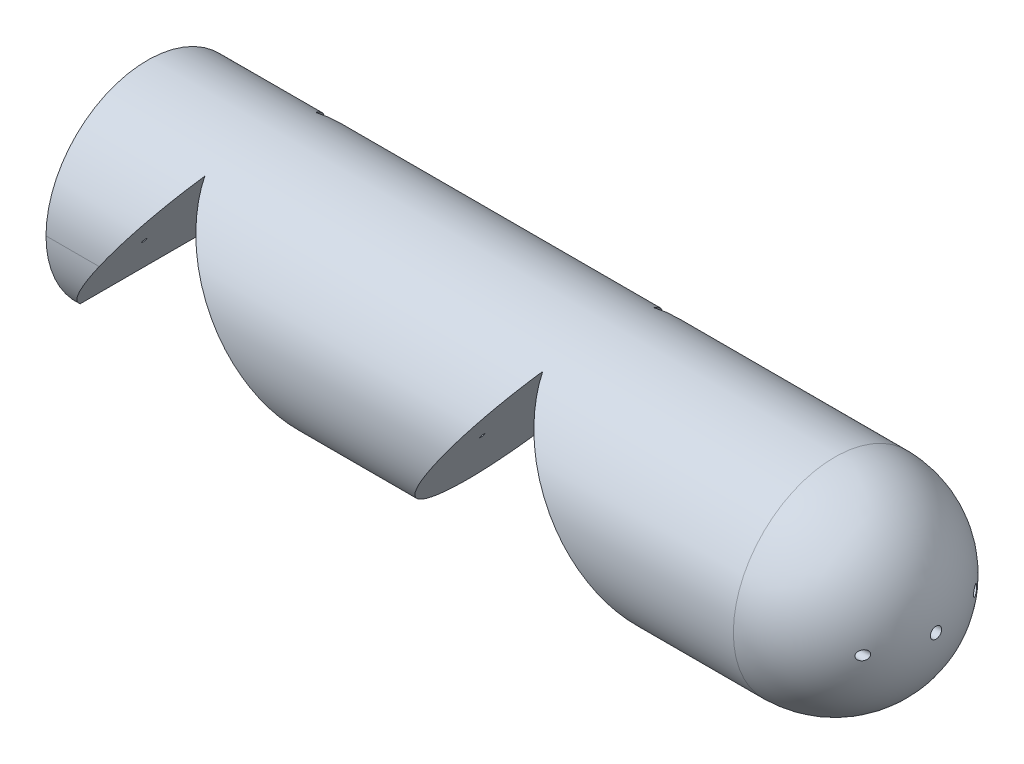
from build123d import *

# Parameters (mm, degrees)
SKETCH1_W                    = 70
SKETCH1_H                    = 9
FILLET1_R                    = 9
CUT_EXTRUDE1_DEPTH           = 15
SKETCH4_R                    = 0.2
CUT_EXTRUDE2_DEPTH           = 73.835430939
SKETCH5_R                    = 0.5
CUT_EXTRUDE3_DEPTH           = 5
CUT_EXTRUDE3_DRAFT           = -3
CUT_EXTRUDE3_PROFILE_2_DEPTH = 5
CUT_EXTRUDE3_PROFILE_2_DRAFT = -3
CUT_EXTRUDE3_PROFILE_3_DEPTH = 5
CUT_EXTRUDE3_PROFILE_3_DRAFT = -3


with BuildPart() as part:
    # Sketch1 → Revolve1 (revolve)
    with BuildSketch(Plane.XY):
        with Locations((35, 4.5)):
            Rectangle(SKETCH1_W, SKETCH1_H)
    revolve(axis=Axis((0, 9, 0), (1, 0, 0)))

    # Fillet1
    fillet1_edges = [part.edges().sort_by_distance(p)[0] for p in [
        (70, 18, 0),
    ]]
    fillet(fillet1_edges, radius=FILLET1_R)

    # Sketch2 → Cut-Extrude1 (cut, symmetric)
    with BuildSketch(Plane.XY):
        Polygon((-1.583487195, 0), (21.583487195, 0), (10, 16.542934148), align=None)
        Polygon((40, 16.542934148), (28.416512805, 0), (51.583487195, 0), align=None)
    extrude(amount=CUT_EXTRUDE1_DEPTH, both=True, mode=Mode.SUBTRACT)

    # Sketch4 → Cut-Extrude2 (cut, through all)
    with BuildSketch(Plane.ZY):
        with Locations((5, 9)):
            Circle(SKETCH4_R)
        with Locations((0, 9)):
            Circle(SKETCH4_R)
        with Locations((-5, 9)):
            Circle(SKETCH4_R)
    extrude(amount=-CUT_EXTRUDE2_DEPTH, mode=Mode.SUBTRACT)


with BuildPart() as cut_extrude3_tool:
    # Sketch5 → Cut-Extrude3 (with draft: the straight prism first)
    with BuildSketch(Plane(origin=(69.997777503, 0, 0), x_dir=(0, 0, -1), z_dir=(1, 0, 0))):
        with Locations((-5, 9)):
            Circle(SKETCH5_R)
    extrude(amount=-CUT_EXTRUDE3_DEPTH)
    # Cut-Extrude3: the draft: its side faces are tilted about the plane it starts from
    cut_extrude3_sides = [cut_extrude3_tool.faces().sort_by_distance(p)[0] for p in [
        (67.497777503, 9, 5.5),
    ]]
    draft(cut_extrude3_sides, Plane(origin=(69.997777503, 0, 0), x_dir=(0, 0, -1), z_dir=(1, 0, 0)), CUT_EXTRUDE3_DRAFT)


with BuildPart() as part_1:
    add(part.part)

    # Cut-Extrude3: cut by cut_extrude3_tool
    add(cut_extrude3_tool.part, mode=Mode.SUBTRACT)


with BuildPart() as cut_extrude3_profile_2_tool:
    # Sketch5 → Cut-Extrude3 profile 2 (with draft: the straight prism first)
    with BuildSketch(Plane(origin=(69.997777503, 0, 0), x_dir=(0, 0, -1), z_dir=(1, 0, 0))):
        with Locations((0, 9)):
            Circle(SKETCH5_R)
    extrude(amount=-CUT_EXTRUDE3_PROFILE_2_DEPTH)
    # Cut-Extrude3 profile 2: the draft: its side faces are tilted about the plane it starts from
    cut_extrude3_profile_2_sides = [cut_extrude3_profile_2_tool.faces().sort_by_distance(p)[0] for p in [
        (67.497777503, 9, 0.5),
    ]]
    draft(cut_extrude3_profile_2_sides, Plane(origin=(69.997777503, 0, 0), x_dir=(0, 0, -1), z_dir=(1, 0, 0)), CUT_EXTRUDE3_PROFILE_2_DRAFT)


with BuildPart() as part_2:
    add(part_1.part)

    # Cut-Extrude3 profile 2: cut by cut_extrude3_profile_2_tool
    add(cut_extrude3_profile_2_tool.part, mode=Mode.SUBTRACT)


with BuildPart() as cut_extrude3_profile_3_tool:
    # Sketch5 → Cut-Extrude3 profile 3 (with draft: the straight prism first)
    with BuildSketch(Plane(origin=(69.997777503, 0, 0), x_dir=(0, 0, -1), z_dir=(1, 0, 0))):
        with Locations((5, 9)):
            Circle(SKETCH5_R)
    extrude(amount=-CUT_EXTRUDE3_PROFILE_3_DEPTH)
    # Cut-Extrude3 profile 3: the draft: its side faces are tilted about the plane it starts from
    cut_extrude3_profile_3_sides = [cut_extrude3_profile_3_tool.faces().sort_by_distance(p)[0] for p in [
        (67.497777503, 9, -4.5),
    ]]
    draft(cut_extrude3_profile_3_sides, Plane(origin=(69.997777503, 0, 0), x_dir=(0, 0, -1), z_dir=(1, 0, 0)), CUT_EXTRUDE3_PROFILE_3_DRAFT)


with BuildPart() as part_3:
    add(part_2.part)

    # Cut-Extrude3 profile 3: cut by cut_extrude3_profile_3_tool
    add(cut_extrude3_profile_3_tool.part, mode=Mode.SUBTRACT)


solid = part_3.part
